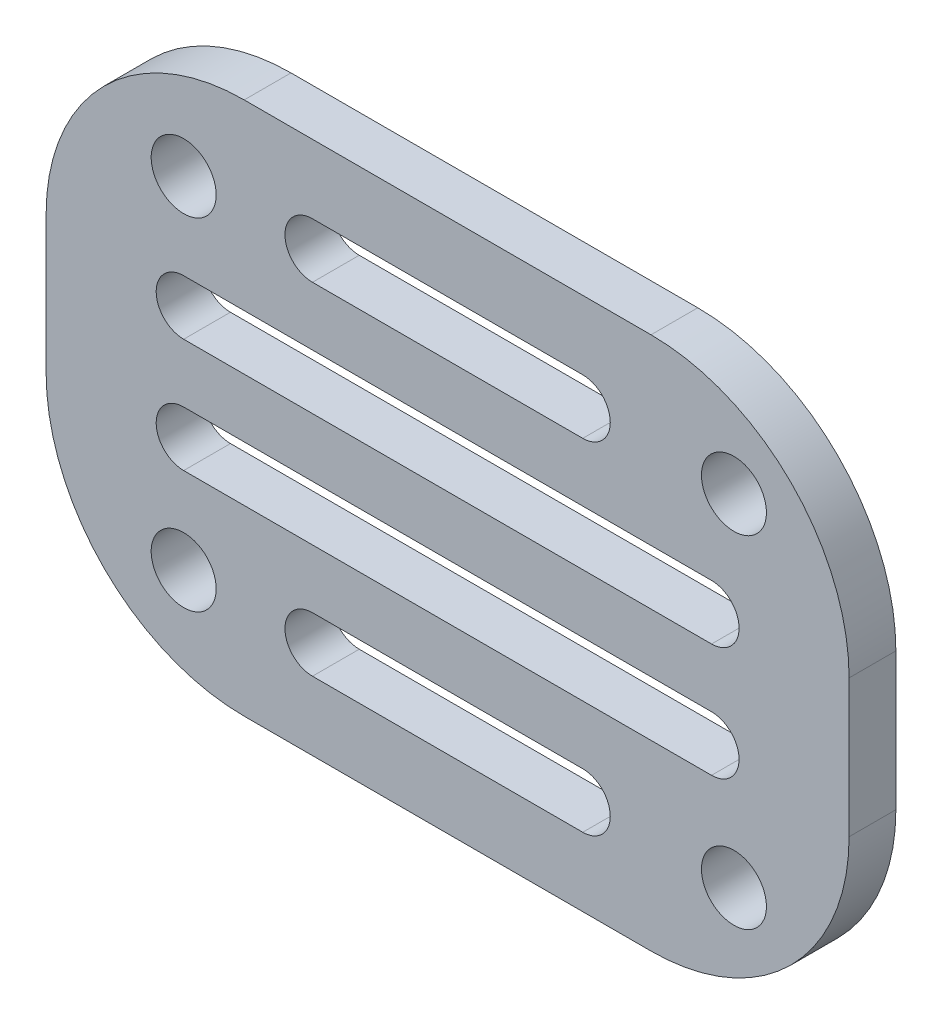
from build123d import *

# Parameters (mm, degrees)
SKETCH1_R           = 1.5
BOSS_EXTRUDE1_DEPTH = 2.159
CUT_EXTRUDE1_DEPTH  = 23.788627471


with BuildPart() as part:
    # Sketch1 → Boss-Extrude1 (new body)
    with BuildSketch(Plane.XY):
        with BuildLine():
            Line((8.872225801, 12.319), (-9.906, 12.319))
            ThreePointArc((-9.906, 12.319), (-16.371784407, 9.640784407), (-19.05, 3.175))
            Line((-19.05, 3.175), (-19.05, -3.175))
            ThreePointArc((-19.05, -3.175), (-16.371784407, -9.640784407), (-9.906, -12.319))
            Line((-9.906, -12.319), (8.872225801, -12.319))
            ThreePointArc((8.872225801, -12.319), (15.338010208, -9.640784407), (18.016225801, -3.175))
            Line((18.016225801, -3.175), (18.016225801, 3.175))
            ThreePointArc((18.016225801, 3.175), (15.338010208, 9.640784407), (8.872225801, 12.319))
        make_face()
        with Locations((-12.7, -7.874)):
            Circle(SKETCH1_R, mode=Mode.SUBTRACT)
        with Locations((12.7, -7.874)):
            Circle(SKETCH1_R, mode=Mode.SUBTRACT)
        with Locations((-12.7, 7.874)):
            Circle(SKETCH1_R, mode=Mode.SUBTRACT)
        with Locations((12.7, 7.874)):
            Circle(SKETCH1_R, mode=Mode.SUBTRACT)
    extrude(amount=BOSS_EXTRUDE1_DEPTH)

    # Sketch4 → Cut-Extrude1 (cut, through all)
    with BuildSketch(Plane.XY.offset(2.159)):
        with BuildLine():
            Line((-6.755, 9.144), (5.721225801, 9.144))
            ThreePointArc((5.721225801, 9.144), (6.991225801, 7.874), (5.721225801, 6.604))
            Line((5.721225801, 6.604), (-6.755, 6.604))
            ThreePointArc((-6.755, 6.604), (-8.025, 7.874), (-6.755, 9.144))
        make_face()
        with BuildLine():
            Line((-12.7, 3.894666667), (11.666225801, 3.894666667))
            ThreePointArc((11.666225801, 3.894666667), (12.936225801, 2.624666667), (11.666225801, 1.354666667))
            Line((11.666225801, 1.354666667), (-12.7, 1.354666667))
            ThreePointArc((-12.7, 1.354666667), (-13.97, 2.624666667), (-12.7, 3.894666667))
        make_face()
        with BuildLine():
            Line((-12.7, -1.354666667), (11.666225801, -1.354666667))
            ThreePointArc((11.666225801, -1.354666667), (12.936225801, -2.624666667), (11.666225801, -3.894666667))
            Line((11.666225801, -3.894666667), (-12.7, -3.894666667))
            ThreePointArc((-12.7, -3.894666667), (-13.97, -2.624666667), (-12.7, -1.354666667))
        make_face()
        with BuildLine():
            Line((-6.755, -6.604), (5.721225801, -6.604))
            ThreePointArc((5.721225801, -6.604), (6.991225801, -7.874), (5.721225801, -9.144))
            Line((5.721225801, -9.144), (-6.755, -9.144))
            ThreePointArc((-6.755, -9.144), (-8.025, -7.874), (-6.755, -6.604))
        make_face()
    extrude(amount=-CUT_EXTRUDE1_DEPTH, mode=Mode.SUBTRACT)


solid = part.part
